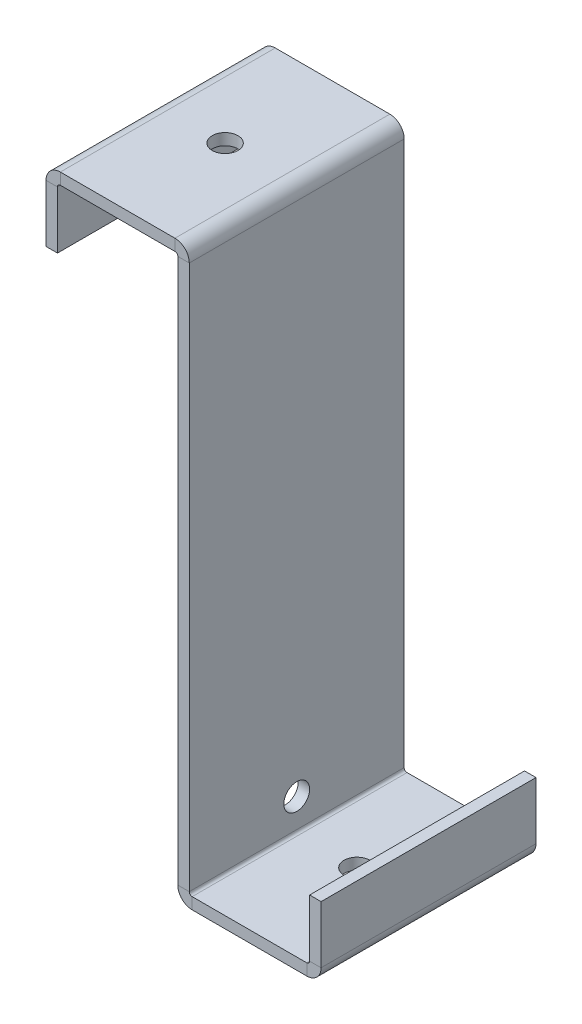
from build123d import *

# Parameters (mm, degrees)
BASEFLANGE_W                   = 75
BASEFLANGE_H                   = 200
BASE_FLANGE1_DEPTH             = 4
EDGE_FLANGE1_STRIP_W           = 18
EDGE_FLANGE1_STRIP_H           = 4
EDGE_FLANGE1_STRIP_CUT_DEPTH   = 75
EDGE_FLANGE1_STRIP_2_W         = 18
EDGE_FLANGE1_STRIP_2_H         = 4
EDGE_FLANGE1_STRIP_CUT_2_DEPTH = 75
EDGE_FLANGE1_DEPTH             = 75
EDGE_FLANGE1_BEND_DEPTH        = 75
EDGE_FLANGE2_STRIP_W           = 18
EDGE_FLANGE2_STRIP_H           = 4
EDGE_FLANGE2_STRIP_CUT_DEPTH   = 75
EDGE_FLANGE2_STRIP_2_W         = 18
EDGE_FLANGE2_STRIP_2_H         = 4
EDGE_FLANGE2_STRIP_CUT_2_DEPTH = 75
EDGE_FLANGE2_DEPTH             = 75
EDGE_FLANGE2_BEND_DEPTH        = 75
SKETCH15_R                     = 4.5
EXTRUDE1_DEPTH                 = 4
SKETCH16_R                     = 4.5
EXTRUDE2_DEPTH                 = 4
SKETCH17_R                     = 4.5
CUT_EXTRUDE1_DEPTH             = 4


# Sheet-metal steps are written as plain solids
with BuildPart() as part:
    # BaseFlange → Base-Flange1 (new body)
    with BuildSketch(Plane(origin=(0, 0, 0), x_dir=(0, 0, -1), z_dir=(1, 0, 0))):
        with Locations((0, 100)):
            Rectangle(BASEFLANGE_W, BASEFLANGE_H)
    extrude(amount=BASE_FLANGE1_DEPTH)

    # Edge-Flange1 strip (across the edge) → Edge-Flange1 strip cut (cut)
    with BuildSketch(Plane(origin=(0, 200, 37.5), x_dir=(0, -1, 0), z_dir=(0, 0, -1))):
        with Locations((-4, -2)):
            Rectangle(EDGE_FLANGE1_STRIP_W, EDGE_FLANGE1_STRIP_H)
    extrude(amount=EDGE_FLANGE1_STRIP_CUT_DEPTH, mode=Mode.SUBTRACT)

    # Edge-Flange1 strip 2 (across the edge) → Edge-Flange1 strip cut 2 (cut)
    with BuildSketch(Plane(origin=(4, 0, 37.5), x_dir=(0, 1, 0), z_dir=(0, 0, -1))):
        with Locations((-4, -2)):
            Rectangle(EDGE_FLANGE1_STRIP_2_W, EDGE_FLANGE1_STRIP_2_H)
    extrude(amount=EDGE_FLANGE1_STRIP_CUT_2_DEPTH, mode=Mode.SUBTRACT)

    # Edge-Flange1 section (across the edge) → Edge-Flange1 (add)
    with BuildSketch(Plane(origin=(0, 200, 37.5), x_dir=(0, -1, 0), z_dir=(0, 0, -1))):
        with BuildLine():
            Line((0, 1), (0, 46))
            Line((0, 46), (4, 46))
            Line((4, 46), (4, 1))
            ThreePointArc((4, 1), (4.292893219, 0.292893219), (5, 0))
            Line((5, 0), (5, -4))
            ThreePointArc((5, -4), (1.464466094, -2.535533906), (0, 1))
        make_face()
    extrude(amount=EDGE_FLANGE1_DEPTH)

    # Edge-Flange1 section 2 (across the edge) → Edge-Flange1 bend (add)
    with BuildSketch(Plane(origin=(4, 0, 37.5), x_dir=(0, 1, 0), z_dir=(0, 0, -1))):
        with BuildLine():
            Line((0, 1), (0, 46))
            Line((0, 46), (4, 46))
            Line((4, 46), (4, 1))
            ThreePointArc((4, 1), (4.292893219, 0.292893219), (5, 0))
            Line((5, 0), (5, -4))
            ThreePointArc((5, -4), (1.464466094, -2.535533906), (0, 1))
        make_face()
    extrude(amount=EDGE_FLANGE1_BEND_DEPTH)

    # Edge-Flange2 strip (across the edge) → Edge-Flange2 strip cut (cut)
    with BuildSketch(Plane(origin=(-46, 196, 37.5), x_dir=(1, 0, 0), z_dir=(0, 0, -1))):
        with Locations((-4, -2)):
            Rectangle(EDGE_FLANGE2_STRIP_W, EDGE_FLANGE2_STRIP_H)
    extrude(amount=EDGE_FLANGE2_STRIP_CUT_DEPTH, mode=Mode.SUBTRACT)

    # Edge-Flange2 strip 2 (across the edge) → Edge-Flange2 strip cut 2 (cut)
    with BuildSketch(Plane(origin=(50, 4, 37.5), x_dir=(-1, 0, 0), z_dir=(0, 0, -1))):
        with Locations((-4, -2)):
            Rectangle(EDGE_FLANGE2_STRIP_2_W, EDGE_FLANGE2_STRIP_2_H)
    extrude(amount=EDGE_FLANGE2_STRIP_CUT_2_DEPTH, mode=Mode.SUBTRACT)

    # Edge-Flange2 section (across the edge) → Edge-Flange2 (add)
    with BuildSketch(Plane(origin=(-46, 196, 37.5), x_dir=(1, 0, 0), z_dir=(0, 0, -1))):
        with BuildLine():
            Line((0, 1), (0, 21))
            Line((0, 21), (4, 21))
            Line((4, 21), (4, 1))
            ThreePointArc((4, 1), (4.292893219, 0.292893219), (5, 0))
            Line((5, 0), (5, -4))
            ThreePointArc((5, -4), (1.464466094, -2.535533906), (0, 1))
        make_face()
    extrude(amount=EDGE_FLANGE2_DEPTH)

    # Edge-Flange2 section 2 (across the edge) → Edge-Flange2 bend (add)
    with BuildSketch(Plane(origin=(50, 4, 37.5), x_dir=(-1, 0, 0), z_dir=(0, 0, -1))):
        with BuildLine():
            Line((0, 1), (0, 21))
            Line((0, 21), (4, 21))
            Line((4, 21), (4, 1))
            ThreePointArc((4, 1), (4.292893219, 0.292893219), (5, 0))
            Line((5, 0), (5, -4))
            ThreePointArc((5, -4), (1.464466094, -2.535533906), (0, 1))
        make_face()
    extrude(amount=EDGE_FLANGE2_BEND_DEPTH)

    # Sketch15 → Extrude1 (cut)
    with BuildSketch(Plane(origin=(0, 200, 0), x_dir=(1, 0, 0), z_dir=(0, 1, 0))):
        with Locations(Location((-21, 0, 0), (0, 0, 180))):
            Circle(SKETCH15_R)
    extrude(amount=-EXTRUDE1_DEPTH, mode=Mode.SUBTRACT)

    # Sketch16 → Extrude2 (cut)
    with BuildSketch(Plane.XZ):
        with Locations((25, 0)):
            Circle(SKETCH16_R)
    extrude(amount=-EXTRUDE2_DEPTH, mode=Mode.SUBTRACT)

    # Sketch17 → Cut-Extrude1 (cut)
    with BuildSketch(Plane.ZY):
        with Locations((0, 15)):
            Circle(SKETCH17_R)
    extrude(amount=-CUT_EXTRUDE1_DEPTH, mode=Mode.SUBTRACT)


solid = part.part
